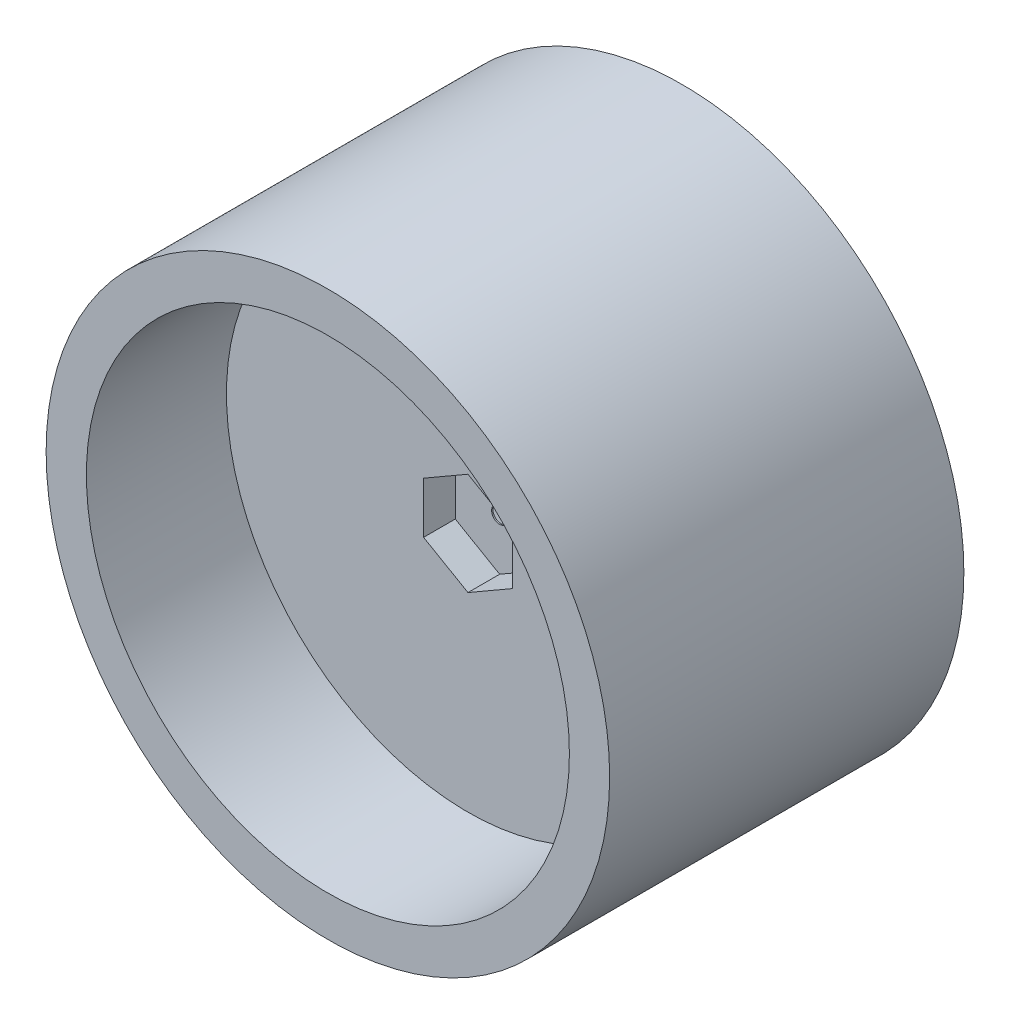
from build123d import *

# Parameters (mm, degrees)
SKETCH1_R           = 44.45
BOSS_EXTRUDE1_DEPTH = 55.88
SKETCH2_R           = 38.1
CUT_EXTRUDE1_DEPTH  = 22.098
CUT_EXTRUDE2_START  = -28.575
SKETCH3_R           = 38.1
CUT_EXTRUDE2_DEPTH  = 28.575
SKETCH4_R           = 1.27
CUT_EXTRUDE3_DEPTH  = 72.364056247
CUT_EXTRUDE4_DEPTH  = 5


with BuildPart() as part:
    # Sketch1 → Boss-Extrude1 (new body)
    with BuildSketch(Plane.XY):
        Circle(SKETCH1_R)
    extrude(amount=BOSS_EXTRUDE1_DEPTH)

    # Sketch2 → Cut-Extrude1 (cut)
    with BuildSketch(Plane.XY.offset(55.88)):
        Circle(SKETCH2_R)
    extrude(amount=-CUT_EXTRUDE1_DEPTH, mode=Mode.SUBTRACT)

    # Sketch3 → Cut-Extrude2 (cut)
    with BuildSketch(Plane(origin=(0, 0, 0), x_dir=(-1, 0, 0), z_dir=(0, 0, -1)).offset(CUT_EXTRUDE2_START)):
        Circle(SKETCH3_R)
    extrude(amount=CUT_EXTRUDE2_DEPTH, mode=Mode.SUBTRACT)

    # Sketch4 → Cut-Extrude3 (cut, through all)
    with BuildSketch(Plane.XY.offset(33.782)):
        Circle(SKETCH4_R)
    extrude(amount=-CUT_EXTRUDE3_DEPTH, mode=Mode.SUBTRACT)

    # Sketch5 → Cut-Extrude4 (cut)
    with BuildSketch(Plane.XY.offset(33.782)):
        Polygon((0, 8.082903769), (-7, 4.041451884), (-7, -4.041451884), (0, -8.082903769), (7, -4.041451884), (7, 4.041451884), align=None)
    extrude(amount=-CUT_EXTRUDE4_DEPTH, mode=Mode.SUBTRACT)


solid = part.part
